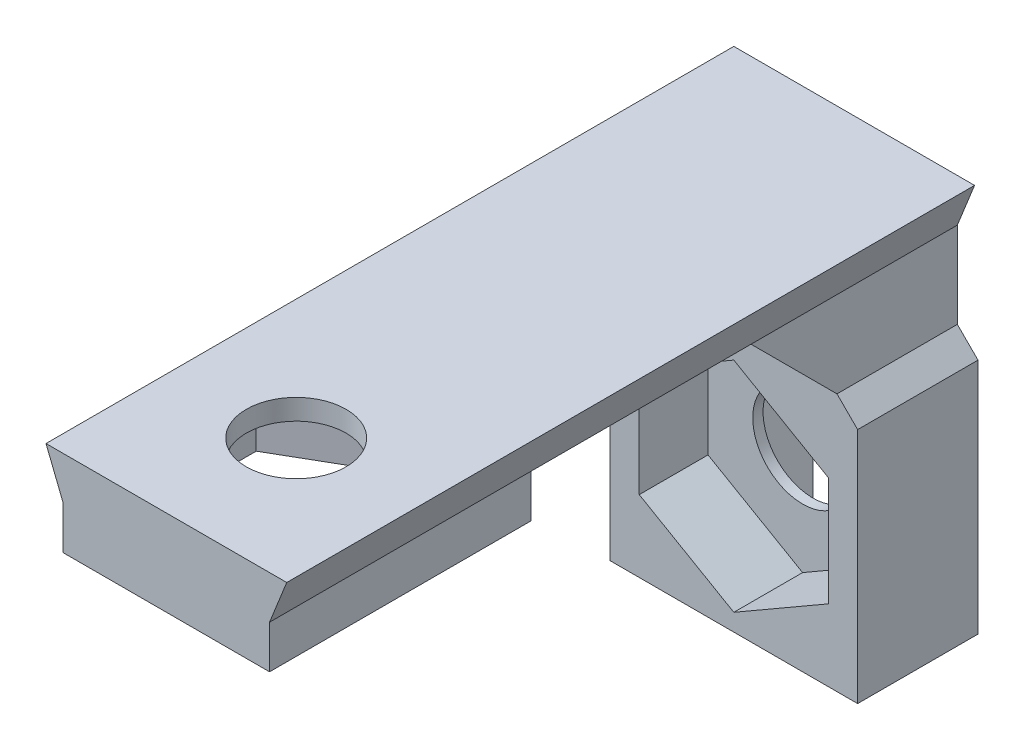
from build123d import *

# Parameters (mm, degrees)
SKETCH1_W               = 12
SKETCH1_H               = 7
BOSS_EXTRUDE1_DEPTH     = 20
CUT_EXTRUDE1_DEPTH      = 20
CUT_EXTRUDE2_REACH      = 24.023
SKETCH3_R               = 2.9
CUT_EXTRUDE3_DEPTH      = 4
SKETCH5_W               = 14
SKETCH5_H               = 40
BOSS_EXTRUDE2_DEPTH     = 2.5
CUT_EXTRUDE4_REACH      = 48.425
SKETCH14_W              = 12
SKETCH14_H              = 15.2
BOSS_EXTRUDE6_DEPTH     = 2.5
CUT_EXTRUDE6_DEPTH      = 2.5
CUT_EXTRUDE6_DEPTH_BACK = 1.3
CUT_EXTRUDE7_REACH      = 44.836
SKETCH9_R               = 2.9
SKETCH10_W              = 1.2
SKETCH10_H              = 7
BOSS_EXTRUDE3_DEPTH     = 15
CHAMFER1_SIZE           = 1.2
SKETCH12_W              = 12
SKETCH12_H              = 5
BOSS_EXTRUDE5_DEPTH     = 10
CHAMFER3_SIZE           = 10


# Some blends are built 0.0001 mm under size
with BuildPart() as part:
    # Sketch1 → Boss-Extrude1 (new body)
    with BuildSketch(Plane(origin=(0, 0, 0), x_dir=(1, 0, 0), z_dir=(0, 1, 0))):
        Rectangle(SKETCH1_W, SKETCH1_H)
    extrude(amount=BOSS_EXTRUDE1_DEPTH)

    # Sketch2 → Cut-Extrude1 (cut)
    with BuildSketch(Plane(origin=(0, 20, 0), x_dir=(1, 0, 0), z_dir=(0, 1, 0))):
        Polygon((0, 3.5), (2.4, 3.5), (4.8, 1.1), (0, 1.1), (-4.8, 1.1), (-2.4, 3.5), align=None)
    extrude(amount=-CUT_EXTRUDE1_DEPTH, mode=Mode.SUBTRACT)

    # Sketch3 → Cut-Extrude2 (cut, up to next)
    with BuildSketch(Plane.XY.offset(3.5), mode=Mode.PRIVATE) as cut_extrude2_sk1:
        with Locations((0, 7.35)):
            Circle(SKETCH3_R)
    cut_extrude2_tool1 = extrude(cut_extrude2_sk1.sketch, amount=-CUT_EXTRUDE2_REACH, mode=Mode.PRIVATE) & part.part
    add(cut_extrude2_tool1.solids().sort_by_distance((0, 7.35, 3.5))[0], mode=Mode.SUBTRACT)

    # Sketch4 → Cut-Extrude3 (cut)
    with BuildSketch(Plane.XY.offset(3.5)):
        Polygon((0, 13.700852961), (-5.5, 10.525426481), (-5.5, 4.174573519), (0, 0.999147039), (5.5, 4.174573519), (5.5, 10.525426481), align=None)
    extrude(amount=-CUT_EXTRUDE3_DEPTH, mode=Mode.SUBTRACT)

    # Sketch5 → Boss-Extrude2 (add)
    with BuildSketch(Plane(origin=(0, 20, 0), x_dir=(1, 0, 0), z_dir=(0, 1, 0))):
        with Locations((0, -16.5)):
            Rectangle(SKETCH5_W, SKETCH5_H)
    extrude(amount=BOSS_EXTRUDE2_DEPTH)

    # Sketch6 → Cut-Extrude4 (cut, up to next)
    with BuildSketch(Plane(origin=(0, 0, -3.5), x_dir=(-1, 0, 0), z_dir=(0, 0, -1)), mode=Mode.PRIVATE) as cut_extrude4_sk1:
        Polygon((-7, 20), (-7, 22.5), (-6, 20), align=None)
    cut_extrude4_tool1 = extrude(cut_extrude4_sk1.sketch, amount=-CUT_EXTRUDE4_REACH, mode=Mode.PRIVATE) & part.part
    # Sketch6 → Cut-Extrude4 (cut, up to next)
    with BuildSketch(Plane(origin=(0, 0, -3.5), x_dir=(-1, 0, 0), z_dir=(0, 0, -1)), mode=Mode.PRIVATE) as cut_extrude4_sk2:
        Polygon((7, 20), (6, 20), (7, 22.5), align=None)
    cut_extrude4_tool2 = extrude(cut_extrude4_sk2.sketch, amount=-CUT_EXTRUDE4_REACH, mode=Mode.PRIVATE) & part.part
    add(cut_extrude4_tool1.solids().sort_by_distance((6.666667, 20.833333, -3.5))[0], mode=Mode.SUBTRACT)
    add(cut_extrude4_tool2.solids().sort_by_distance((-6.666667, 20.833333, -3.5))[0], mode=Mode.SUBTRACT)

    # Sketch14 → Boss-Extrude6 (add)
    with BuildSketch(Plane.XZ.offset(-20)):
        with Locations((0, 28.9)):
            Rectangle(SKETCH14_W, SKETCH14_H)
    extrude(amount=BOSS_EXTRUDE6_DEPTH)

    # Sketch8 → Cut-Extrude6 (cut, two sides: drawn at the far end of the back side and taken through both)
    with BuildSketch(Plane.XZ.offset(-20).offset(-CUT_EXTRUDE6_DEPTH_BACK)):
        Polygon((0, 22.599147039), (5.5, 25.774573519), (5.5, 32.125426481), (0, 35.300852961), (-5.5, 32.125426481), (-5.5, 25.774573519), align=None)
    extrude(amount=CUT_EXTRUDE6_DEPTH + CUT_EXTRUDE6_DEPTH_BACK, mode=Mode.SUBTRACT)

    # Sketch9 → Cut-Extrude7 (cut, up to next)
    with BuildSketch(Plane(origin=(0, 21.3, 0), x_dir=(-1, 0, 0), z_dir=(0, -1, 0)), mode=Mode.PRIVATE) as cut_extrude7_sk1:
        with Locations(Location((0, -28.95, 0), (0, 0, 90))):
            Circle(SKETCH9_R)
    cut_extrude7_tool1 = extrude(cut_extrude7_sk1.sketch, amount=-CUT_EXTRUDE7_REACH, mode=Mode.PRIVATE) & part.part
    add(cut_extrude7_tool1.solids().sort_by_distance((0, 21.3, 28.95))[0], mode=Mode.SUBTRACT)

    # Sketch10 → Boss-Extrude3 (add)
    with BuildSketch(Plane.XZ):
        with Locations((-6.6, 0)):
            Rectangle(SKETCH10_W, SKETCH10_H)
        with Locations((6.6, 0)):
            Rectangle(SKETCH10_W, SKETCH10_H)
    extrude(amount=-BOSS_EXTRUDE3_DEPTH)

    # Chamfer1
    chamfer1_edges = [part.edges().sort_by_distance(p)[0] for p in [
        (7.2, 15, 0),
        (-7.2, 15, 0),
    ]]
    chamfer(chamfer1_edges, length=CHAMFER1_SIZE - 0.0001)  # a hair under: the kernel refuses the full size

    # Sketch12 → Boss-Extrude5 (add)
    with BuildSketch(Plane.XY.offset(3.5)):
        with Locations((0, 17.5)):
            Rectangle(SKETCH12_W, SKETCH12_H)
    extrude(amount=BOSS_EXTRUDE5_DEPTH)

    # Chamfer3
    # the kernel refuses this chamfer: 10 mm, written as the material it takes off along each edge
    with BuildSketch(Plane(origin=(31.71682988, 15, 13.5), x_dir=(0, -0.027495876610586317, -0.9996219169112968), z_dir=(-1, 0, 0))) as chamfer3_piece_1_section:
        Polygon((CHAMFER3_SIZE * 0.999621916911, -CHAMFER3_SIZE * 0.0274958766106), (-CHAMFER3_SIZE * 0.0274958766106, -CHAMFER3_SIZE * 0.999621916911), (0, 0), align=None)
    chamfer3_piece_1 = extrude(amount=63.433659759, mode=Mode.PRIVATE)
    chamfer3_piece_1 = split(chamfer3_piece_1, bisect_by=Plane(origin=(4.860757505, 20, 8.732154153), z_dir=(0, -1, 0)), keep=Keep.TOP, mode=Mode.PRIVATE)
    add(chamfer3_piece_1, mode=Mode.SUBTRACT)


solid = part.part
